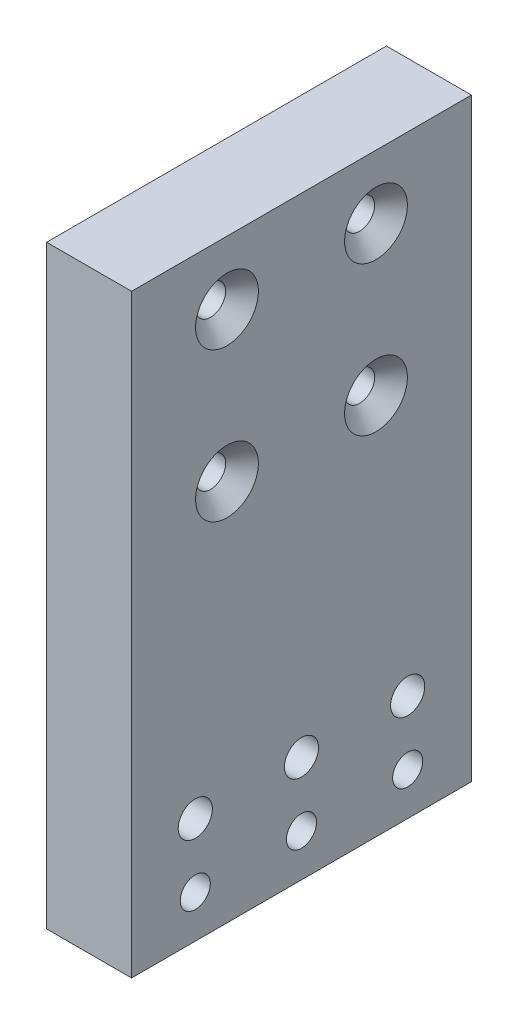
from build123d import *

# Parameters (mm, degrees)
SKETCH1_W                                       = 50.8
SKETCH1_H                                       = 88.9
BOSS_EXTRUDE1_DEPTH                             = 12.7
CSK_FOR_M4_FLAT_HEAD_MACHINE_SCREW1_D           = 4.5
CSK_FOR_M4_FLAT_HEAD_MACHINE_SCREW1_CSINK_D     = 9.4
CSK_FOR_M4_FLAT_HEAD_MACHINE_SCREW1_CSINK_ANGLE = 90
CBORE_FOR_10_SOCKET_HEAD_CAP_SCREW1_D           = 5.1054
CBORE_FOR_10_SOCKET_HEAD_CAP_SCREW1_CBORE_D     = 9.525
CBORE_FOR_10_SOCKET_HEAD_CAP_SCREW1_CBORE_DEPTH = 4.826
CBORE_FOR_8_SOCKET_HEAD_CAP_SCREW1_D            = 4.4958
CBORE_FOR_8_SOCKET_HEAD_CAP_SCREW1_CBORE_D      = 7.9375
CBORE_FOR_8_SOCKET_HEAD_CAP_SCREW1_CBORE_DEPTH  = 4.1656


with BuildPart() as part:
    # Sketch1 → Boss-Extrude1 (new body)
    with BuildSketch(Plane(origin=(0, 0, 0), x_dir=(0, 0, -1), z_dir=(1, 0, 0))):
        Rectangle(SKETCH1_W, SKETCH1_H)
    extrude(amount=BOSS_EXTRUDE1_DEPTH)

    # CSK for M4 Flat Head Machine Screw1 (through all)
    with Locations(Plane(origin=(12.7, 0, 0), x_dir=(0, 0, -1), z_dir=(1, 0, 0))):
        with Locations((11.136931804, 34.973863607), (-11.136931804, 34.973863607), (-11.136931804, 12.7), (11.136931804, 12.7)):
            CounterSinkHole(CSK_FOR_M4_FLAT_HEAD_MACHINE_SCREW1_D / 2, CSK_FOR_M4_FLAT_HEAD_MACHINE_SCREW1_CSINK_D / 2, counter_sink_angle=CSK_FOR_M4_FLAT_HEAD_MACHINE_SCREW1_CSINK_ANGLE)

    # CBORE for #10 Socket Head Cap Screw1 (through all)
    with Locations(Plane.ZY):
        with Locations((-15.875, -28.575), (0, -28.575), (15.875, -28.575)):
            CounterBoreHole(CBORE_FOR_10_SOCKET_HEAD_CAP_SCREW1_D / 2, CBORE_FOR_10_SOCKET_HEAD_CAP_SCREW1_CBORE_D / 2, CBORE_FOR_10_SOCKET_HEAD_CAP_SCREW1_CBORE_DEPTH)

    # CBORE for #8 Socket Head Cap Screw1 (through all)
    with Locations(Plane.ZY):
        with Locations((-15.875, -38.1), (0, -38.1), (15.875, -38.1)):
            CounterBoreHole(CBORE_FOR_8_SOCKET_HEAD_CAP_SCREW1_D / 2, CBORE_FOR_8_SOCKET_HEAD_CAP_SCREW1_CBORE_D / 2, CBORE_FOR_8_SOCKET_HEAD_CAP_SCREW1_CBORE_DEPTH)


solid = part.part
